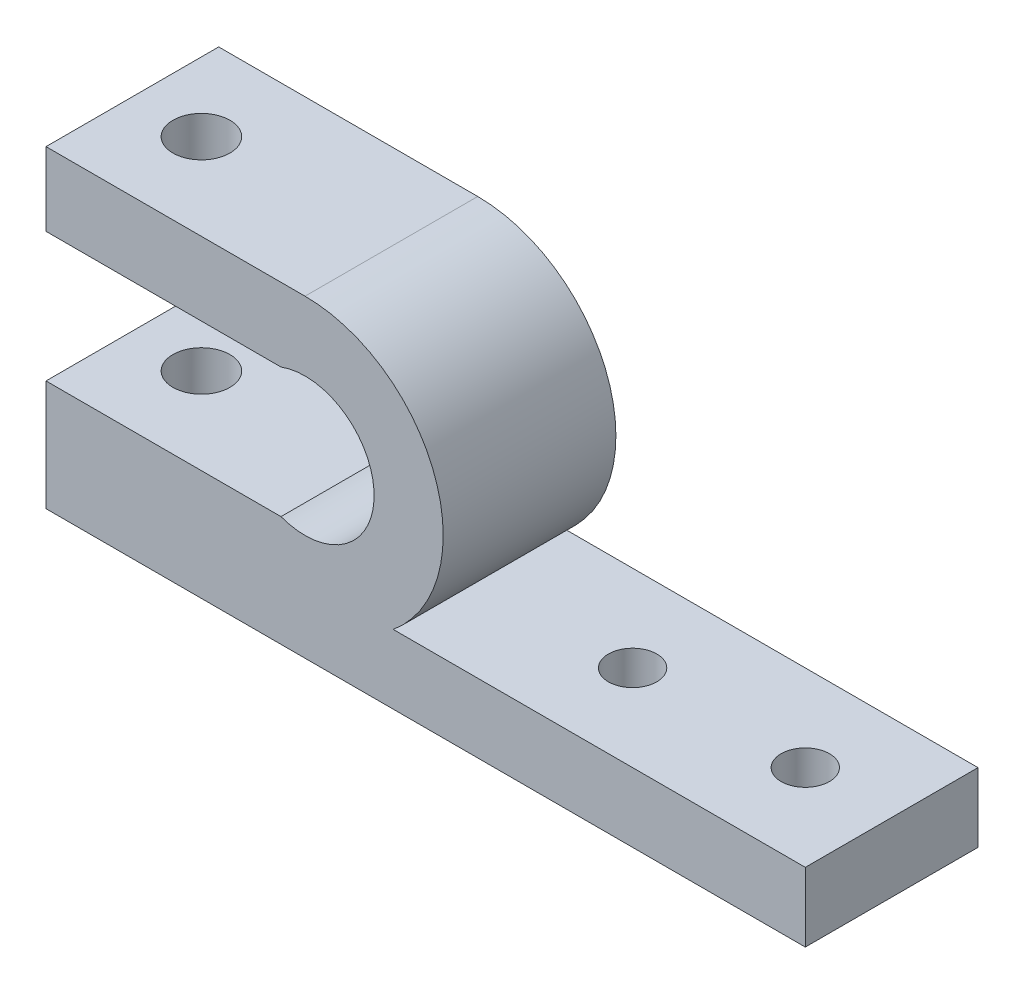
from build123d import *

# Parameters (mm, degrees)
BOSS_EXTRUDE1_DEPTH = 10
SKETCH2_R           = 1.65
CUT_EXTRUDE1_DEPTH  = 28.263351924
BOSS_EXTRUDE2_START = -10
BOSS_EXTRUDE2_DEPTH = 10
SKETCH6_R           = 1.65
CUT_EXTRUDE2_DEPTH  = 45.812910671
SKETCH8_R           = 1.4
CUT_EXTRUDE3_DEPTH  = 10


with BuildPart() as part:
    # Sketch1 → Boss-Extrude1 (new body)
    with BuildSketch(Plane.XY):
        with BuildLine():
            Line((10.287752964, 23.856798453), (-3.320305945, 23.856798453))
            Line((-3.320305945, 23.856798453), (-3.320305945, 28.106798453))
            Line((-3.320305945, 28.106798453), (11.679694055, 28.106798453))
            ThreePointArc((11.679694055, 28.106798453), (19.679694055, 20.106798453), (11.679694055, 12.106798453))
            Line((11.679694055, 12.106798453), (-3.320305945, 12.106798453))
            Line((-3.320305945, 12.106798453), (-3.320305945, 16.356798453))
            Line((-3.320305945, 16.356798453), (10.287752964, 16.356798453))
            ThreePointArc((10.287752964, 16.356798453), (15.679694055, 20.106798453), (10.287752964, 23.856798453))
        make_face()
    extrude(amount=BOSS_EXTRUDE1_DEPTH)

    # Sketch2 → Cut-Extrude1 (cut, through all)
    with BuildSketch(Plane(origin=(0, 28.106798453, 0), x_dir=(1, 0, 0), z_dir=(0, 1, 0))):
        with Locations((0.679694055, -5)):
            Circle(SKETCH2_R)
    extrude(amount=-CUT_EXTRUDE1_DEPTH, mode=Mode.SUBTRACT)

    # Sketch5 → Boss-Extrude2 (add)
    with BuildSketch(Plane.XY.offset(10).offset(BOSS_EXTRUDE2_START)):
        with BuildLine():
            Line((20.64722577, 13.948922433), (40.64722577, 13.948922433))
            Line((40.64722577, 13.948922433), (40.64722577, 9.948922433))
            Line((40.64722577, 9.948922433), (-3.320305945, 9.948922433))
            Line((-3.320305945, 9.948922433), (-3.320305945, 12.106798453))
            Line((-3.320305945, 12.106798453), (11.679694055, 12.106798453))
            ThreePointArc((11.679694055, 12.106798453), (14.394191416, 12.581407826), (16.786607303, 13.948922433))
            Line((16.786607303, 13.948922433), (20.64722577, 13.948922433))
        make_face()
    extrude(amount=BOSS_EXTRUDE2_DEPTH)

    # Sketch6 → Cut-Extrude2 (cut, through all)
    with BuildSketch(Plane(origin=(0, 12.106798453, 0), x_dir=(1, 0, 0), z_dir=(0, 1, 0))):
        with Locations((0.679694055, -5)):
            Circle(SKETCH6_R)
    extrude(amount=-CUT_EXTRUDE2_DEPTH, mode=Mode.SUBTRACT)

    # Sketch8 → Cut-Extrude3 (cut)
    with BuildSketch(Plane(origin=(0, 13.948922433, 0), x_dir=(1, 0, 0), z_dir=(0, 1, 0))):
        with Locations((25.64722577, -5)):
            Circle(SKETCH8_R)
        with Locations((35.64722577, -5)):
            Circle(SKETCH8_R)
    extrude(amount=-CUT_EXTRUDE3_DEPTH, mode=Mode.SUBTRACT)


solid = part.part
